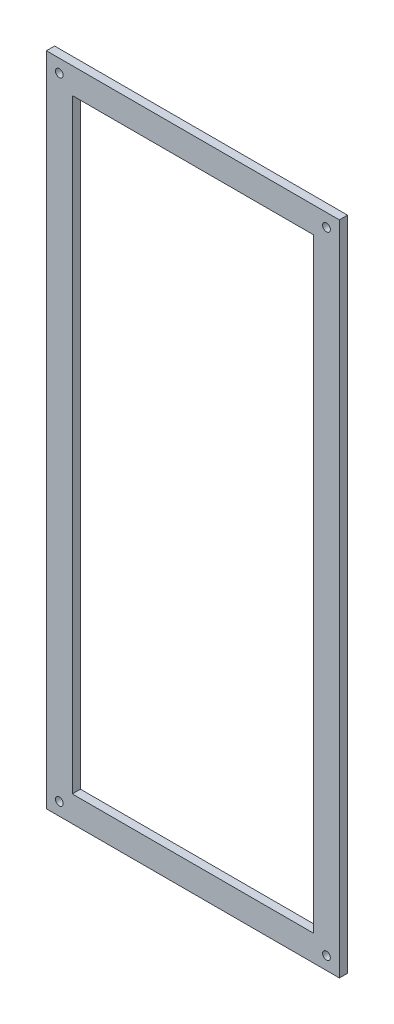
from build123d import *

# Parameters (mm, degrees)
SKETCH1_W           = 113.35
SKETCH1_H           = 254
SKETCH1_R           = 1.5
SKETCH1_W_2         = 93.35
SKETCH1_H_2         = 234
BOSS_EXTRUDE1_DEPTH = 3.175


with BuildPart() as part:
    # Sketch1 → Boss-Extrude1 (new body)
    with BuildSketch(Plane.XY):
        with Locations((56.675, 127)):
            Rectangle(SKETCH1_W, SKETCH1_H)
        with Locations((5, 5)):
            Circle(SKETCH1_R, mode=Mode.SUBTRACT)
        with Locations((5, 249)):
            Circle(SKETCH1_R, mode=Mode.SUBTRACT)
        with Locations((108.35, 5)):
            Circle(SKETCH1_R, mode=Mode.SUBTRACT)
        with Locations((108.35, 249)):
            Circle(SKETCH1_R, mode=Mode.SUBTRACT)
        with Locations((56.675, 127)):
            Rectangle(SKETCH1_W_2, SKETCH1_H_2, mode=Mode.SUBTRACT)
    extrude(amount=BOSS_EXTRUDE1_DEPTH)


solid = part.part
